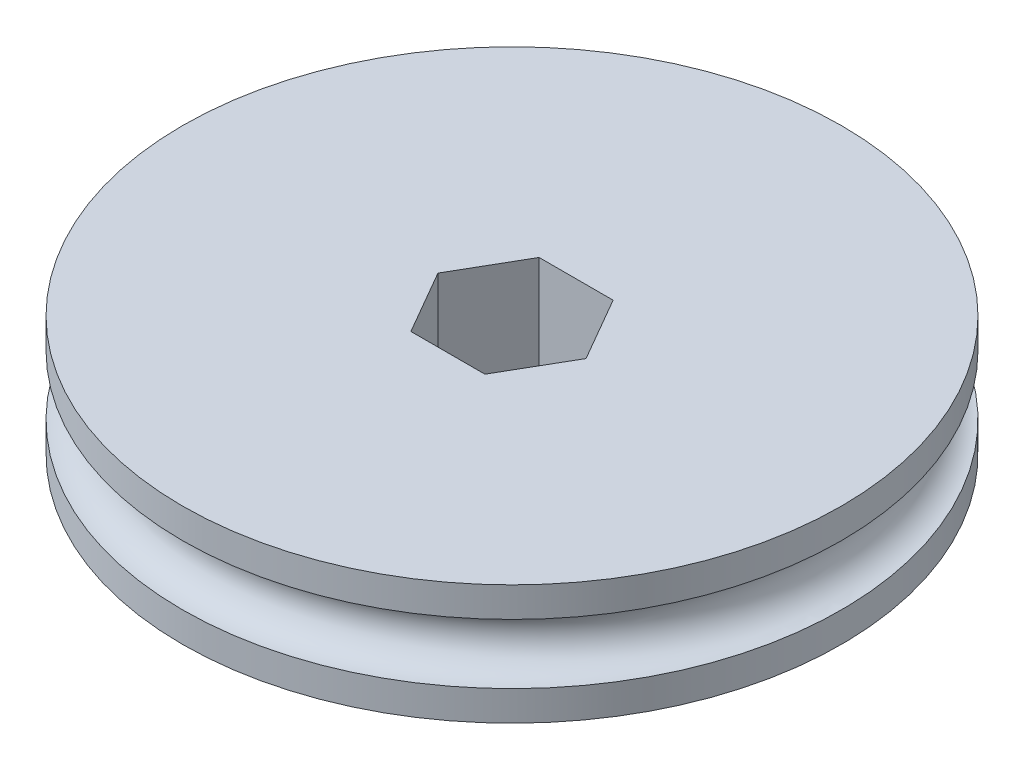
from build123d import *

# Parameters (mm, degrees)
SKETCH1_R           = 34.925
BOSS_EXTRUDE1_DEPTH = 12.7
SKETCH4_R           = 3.175


with BuildPart() as part:
    # Sketch1 → Boss-Extrude1 (new body)
    with BuildSketch(Plane(origin=(0, 0, 0), x_dir=(1, 0, 0), z_dir=(0, 1, 0))):
        Circle(SKETCH1_R)
        Polygon((7.845612808, 0), (3.922806404, 6.7945), (-3.922806404, 6.7945), (-7.845612808, 0), (-3.922806404, -6.7945), (3.922806404, -6.7945), align=None, mode=Mode.SUBTRACT)
    extrude(amount=BOSS_EXTRUDE1_DEPTH)

    # Sketch4 → Cut-Revolve1 (revolve, cut)
    with BuildSketch(Plane(origin=(-6.35, 6.35, 0), x_dir=(0, 1, 0), z_dir=(0, 0, -1))):
        with Locations((0, 41.275)):
            Circle(SKETCH4_R)
    revolve(axis=Axis((0, 12.7, 0), (0, -1, 0)), mode=Mode.SUBTRACT)


solid = part.part
